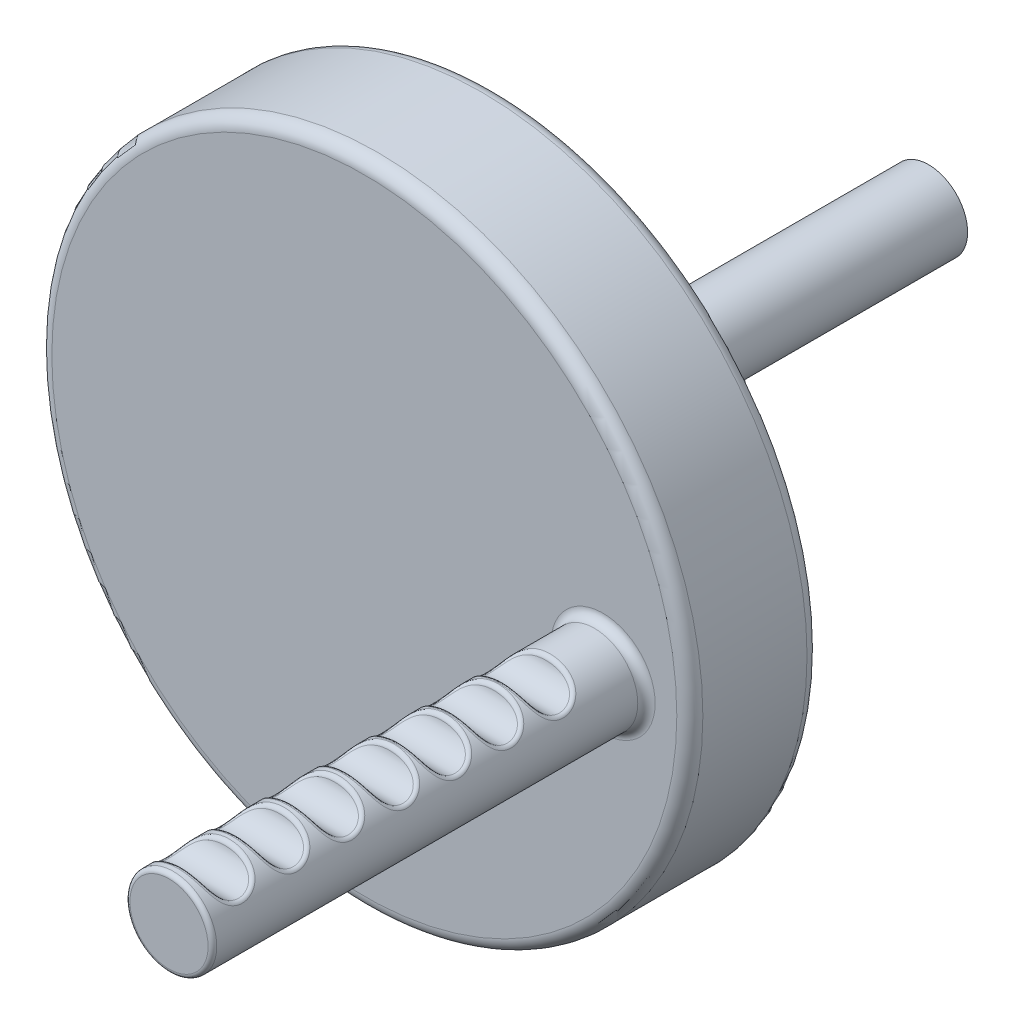
from build123d import *

# Parameters (mm, degrees)
SKETCH1_R               = 9
BOSS_EXTRUDE1_DEPTH     = 50
CUT_EXTRUDE1_START      = -40
CUT_EXTRUDE1_DEPTH      = 40
SKETCH3_R               = 75
BOSS_EXTRUDE2_DEPTH     = 30
SKETCH4_R               = 10
BOSS_EXTRUDE3_DEPTH     = 100
CUT_EXTRUDE2_DEPTH      = 235.360832905
CUT_EXTRUDE2_DEPTH_BACK = 235.360832905
FILLET1_R               = 1
FILLET2_R               = 2
FILLET3_R               = 3


with BuildPart() as part:
    # Sketch1 → Boss-Extrude1 (new, symmetric)
    with BuildSketch(Plane.XY):
        Circle(SKETCH1_R)
    extrude(amount=BOSS_EXTRUDE1_DEPTH, both=True)

    # Sketch2 → Cut-Extrude1 (cut)
    with BuildSketch(Plane(origin=(0, 0, -50), x_dir=(-1, 0, 0), z_dir=(0, 0, -1)).offset(CUT_EXTRUDE1_START)):
        with BuildLine():
            Line((8.485281374, -3), (5.175281374, -3))
            Line((5.175281374, -3), (5.175281374, 3))
            Line((5.175281374, 3), (8.485281374, 3))
            ThreePointArc((8.485281374, 3), (9, 0), (8.485281374, -3))
        make_face()
    extrude(amount=CUT_EXTRUDE1_DEPTH, mode=Mode.SUBTRACT)

    # Sketch3 → Boss-Extrude2 (add)
    with BuildSketch(Plane.XY.offset(50)):
        Circle(SKETCH3_R)
    extrude(amount=BOSS_EXTRUDE2_DEPTH)

    # Sketch4 → Boss-Extrude3 (add)
    with BuildSketch(Plane.XY.offset(80)):
        with Locations((55, 0)):
            Circle(SKETCH4_R)
    extrude(amount=BOSS_EXTRUDE3_DEPTH)

    # Sketch5 → Cut-Extrude2 (cut, two sides: drawn at the far end of the back side and taken through both)
    with BuildSketch(Plane(origin=(55, 0, 0), x_dir=(0, 0, -1), z_dir=(1, 0, 0)).offset(-CUT_EXTRUDE2_DEPTH_BACK)):
        with BuildLine():
            Line((-129.072448042, 10), (-139.069593524, 10))
            ThreePointArc((-139.069593524, 10), (-134.071020783, 5.119459419), (-129.072448042, 10))
        make_face()
        with BuildLine():
            Line((-141.715916867, 10), (-151.713062349, 10))
            ThreePointArc((-151.713062349, 10), (-146.714489608, 5.119459419), (-141.715916867, 10))
        make_face()
        with BuildLine():
            Line((-154.359385693, 10), (-164.356531175, 10))
            ThreePointArc((-164.356531175, 10), (-159.357958434, 5.119459419), (-154.359385693, 10))
        make_face()
        with BuildLine():
            ThreePointArc((-177, 10), (-172.001427259, 5.119459419), (-167.002854518, 10))
            Line((-167.002854518, 10), (-177, 10))
        make_face()
        with BuildLine():
            Line((-117.07530256, 10), (-127.072448042, 10))
            ThreePointArc((-127.072448042, 10), (-122.073875301, 5.119459419), (-117.07530256, 10))
        make_face()
        with BuildLine():
            Line((-105.078157078, 10), (-115.07530256, 10))
            ThreePointArc((-115.07530256, 10), (-110.076729819, 5.119459419), (-105.078157078, 10))
        make_face()
        with BuildLine():
            Line((-93.081011596, 10), (-103.078157078, 10))
            ThreePointArc((-103.078157078, 10), (-98.079584337, 5.119459419), (-93.081011596, 10))
        make_face()
    extrude(amount=CUT_EXTRUDE2_DEPTH + CUT_EXTRUDE2_DEPTH_BACK, mode=Mode.SUBTRACT)

    # Fillet1
    fillet1_edges = [part.edges().sort_by_distance(p)[0] for p in [
        (55, 10, 139.069593524),
        (55, 10, 151.713062349),
        (55, 10, 164.356531175),
        (55, 10, 177),
        (45, 0, 180),
        (55, 10, 103.078157078),
        (55, 10, 115.07530256),
        (55, 10, 127.072448042),
    ]]
    fillet(fillet1_edges, radius=FILLET1_R)

    # Fillet2
    fillet2_edges = [part.edges().sort_by_distance(p)[0] for p in [
        (45, 0, 80),
        (-9, 0, 50),
    ]]
    fillet(fillet2_edges, radius=FILLET2_R)

    # Fillet3
    fillet3_edges = [part.edges().sort_by_distance(p)[0] for p in [
        (-75, 0, 50),
        (-75, 0, 80),
    ]]
    fillet(fillet3_edges, radius=FILLET3_R)


solid = part.part
